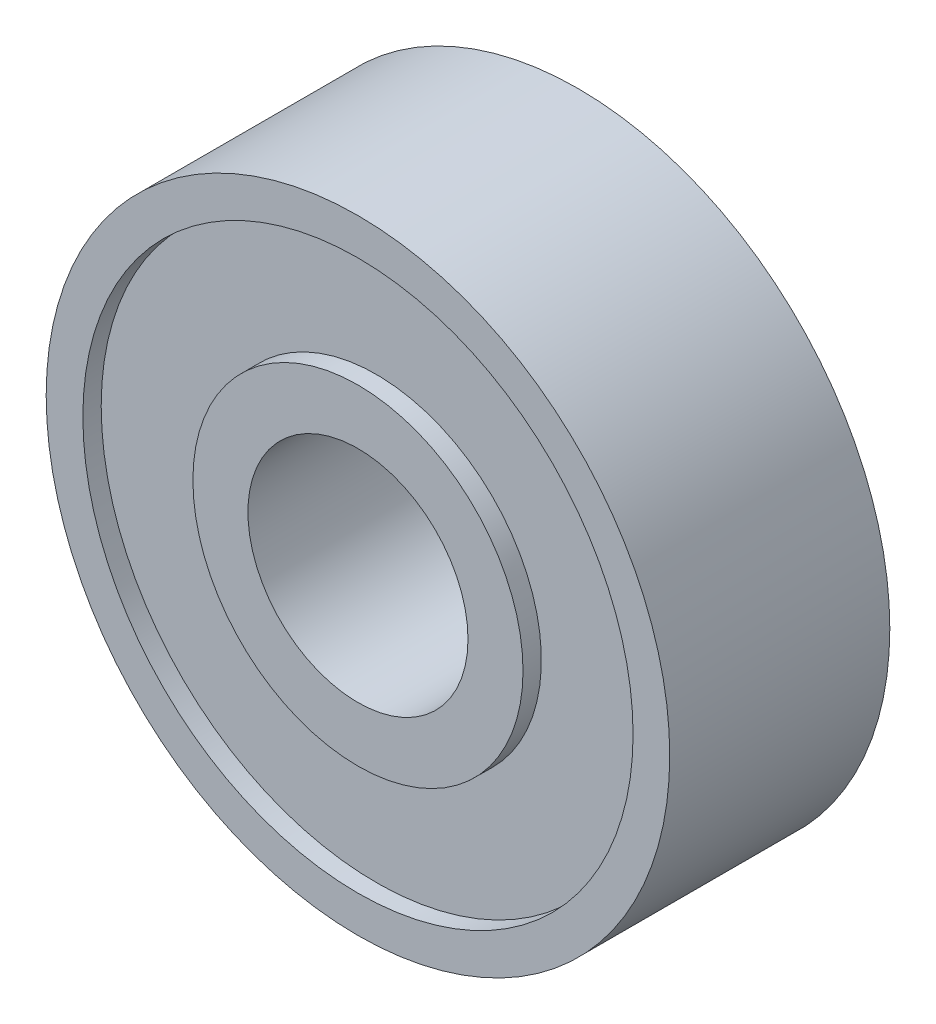
from build123d import *

# Parameters (mm, degrees)
SKETCH1_R           = 8.5
SKETCH1_R_2         = 3
BOSS_EXTRUDE1_DEPTH = 6
SKETCH2_W           = 3
SKETCH2_H           = 1


with BuildPart() as part:
    # Sketch1 → Boss-Extrude1 (new body)
    with BuildSketch(Plane.XY):
        Circle(SKETCH1_R)
        Circle(SKETCH1_R_2, mode=Mode.SUBTRACT)
    extrude(amount=BOSS_EXTRUDE1_DEPTH)

    # Sketch2 → Cut-Revolve1 (revolve, cut)
    with BuildSketch(Plane(origin=(0, 0, 0), x_dir=(1, 0, 0), z_dir=(0, 1, 0))):
        with Locations((-6, 0)):
            Rectangle(SKETCH2_W, SKETCH2_H)
        with Locations((-6, -6)):
            Rectangle(SKETCH2_W, SKETCH2_H)
    revolve(axis=Axis((0, 0, 0), (0, 0, 1)), mode=Mode.SUBTRACT)


solid = part.part
